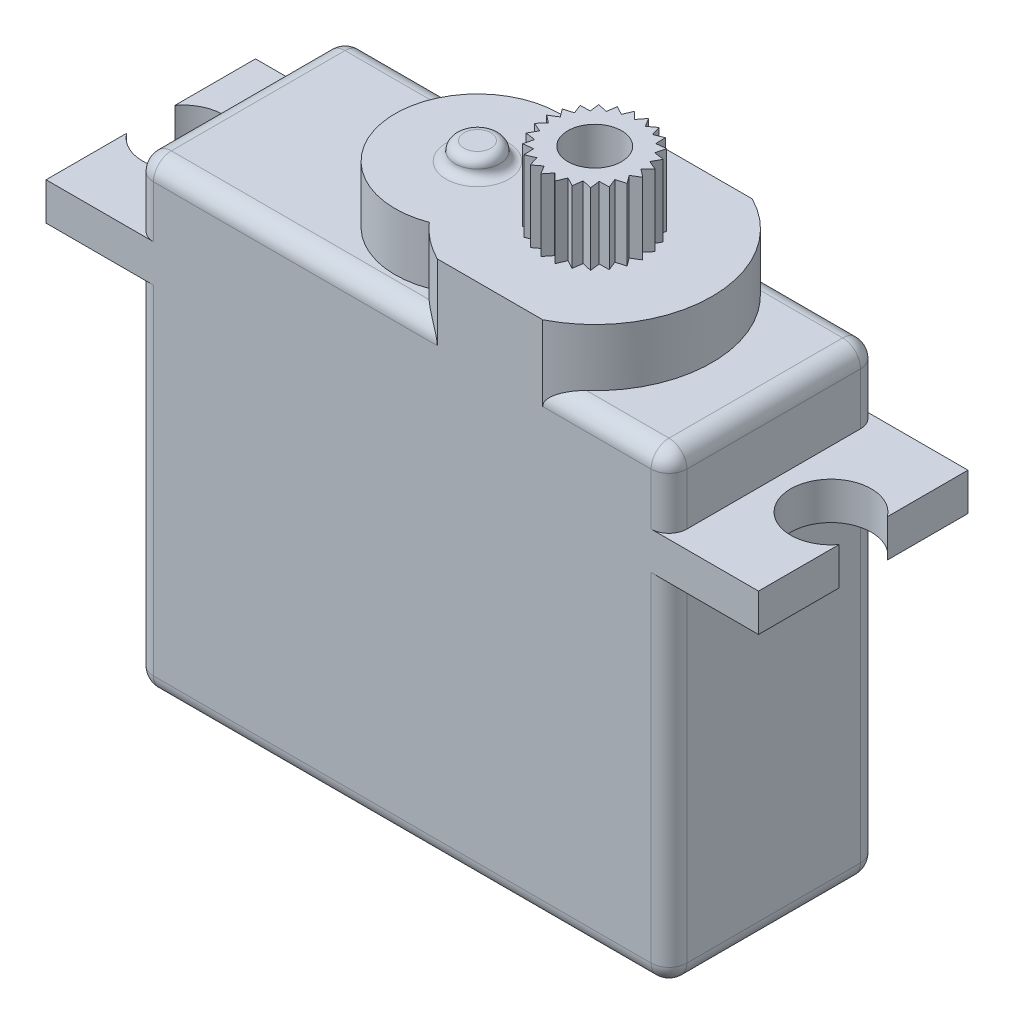
from build123d import *

# Parameters (mm, degrees)
EXTRUDE1_DEPTH    = 5.85
EXTRUDE2_START    = 9.05
SKETCH2_R         = 2.25
EXTRUDE2_DEPTH    = 2.1
EXTRUDE3_START    = 12.95
EXTRUDE3_DEPTH    = 3.2
EXTRUDE6_START    = 16.15
SKETCH6_R         = 1.25
EXTRUDE6_DEPTH    = 1
EXTRUDE4_START    = 16.15
SKETCH4_R         = 2.85
SKETCH4_R_2       = 1.5
EXTRUDE4_DEPTH    = 4
EXTRUDE5_START    = 16.15
EXTRUDE5_DEPTH    = 4
CIRPATTERN1_COUNT = 24
FILLET1_R         = 1
FILLET2_R         = 0.5


with BuildPart() as part:
    # Sketch1 → Extrude1 (new, symmetric)
    with BuildSketch(Plane.XY):
        Polygon((-14.9, -12.95), (-14.9, 6.95), (-19.9, 6.95), (-19.9, 9.05), (-14.9, 9.05), (-14.9, 12.95), (14.9, 12.95), (14.9, 9.05), (19.9, 9.05), (19.9, 6.95), (14.9, 6.95), (14.9, -12.95), align=None)
    extrude(amount=EXTRUDE1_DEPTH, both=True)

    # Sketch2 → Extrude2 (cut)
    with BuildSketch(Plane(origin=(0, 0, 0), x_dir=(1, 0, 0), z_dir=(0, 1, 0)).offset(EXTRUDE2_START)):
        with Locations((-18.1, 0)):
            Circle(SKETCH2_R)
        with Locations((18.1, 0)):
            Circle(SKETCH2_R)
    extrude(amount=-EXTRUDE2_DEPTH, mode=Mode.SUBTRACT)

    # Sketch3 → Extrude3 (add)
    with BuildSketch(Plane(origin=(0, 0, 0), x_dir=(1, 0, 0), z_dir=(0, 1, 0)).offset(EXTRUDE3_START)):
        with BuildLine():
            Line((7.846183973, 5.85), (1.953816027, 5.85))
            ThreePointArc((1.953816027, 5.85), (0.884733475, 5.174952631), (-0.034732824, 4.307076961))
            ThreePointArc((-0.034732824, 4.307076961), (-6.25, 0), (-0.034732824, -4.307076961))
            ThreePointArc((-0.034732824, -4.307076961), (0.884733475, -5.174952631), (1.953816027, -5.85))
            Line((1.953816027, -5.85), (7.846183973, -5.85))
            ThreePointArc((7.846183973, -5.85), (11.45, 0), (7.846183973, 5.85))
        make_face()
    extrude(amount=EXTRUDE3_DEPTH)

    # Sketch6 → Extrude6 (add)
    with BuildSketch(Plane(origin=(0, 0, 0), x_dir=(1, 0, 0), z_dir=(0, 1, 0)).offset(EXTRUDE6_START)):
        with Locations((-1.65, 0)):
            Circle(SKETCH6_R)
    extrude(amount=EXTRUDE6_DEPTH)

    # Sketch4 → Extrude4 (add)
    with BuildSketch(Plane(origin=(0, 0, 0), x_dir=(1, 0, 0), z_dir=(0, 1, 0)).offset(EXTRUDE4_START)):
        with Locations((4.9, 0)):
            Circle(SKETCH4_R)
        with Locations((4.9, 0)):
            Circle(SKETCH4_R_2, mode=Mode.SUBTRACT)
    extrude(amount=EXTRUDE4_DEPTH)

    # Sketch5 → Extrude5 (cut)
    with BuildSketch(Plane(origin=(0, 0, 0), x_dir=(1, 0, 0), z_dir=(0, 1, 0)).offset(EXTRUDE5_START)):
        with BuildLine():
            Line((4.005073985, -2.705846897), (4.447115963, -2.373874784))
            Line((4.447115963, -2.373874784), (4.735892559, -2.845271296))
            ThreePointArc((4.735892559, -2.845271296), (4.365914093, -2.799509286), (4.005073985, -2.705846897))
        make_face()
    extrude5 = extrude(amount=EXTRUDE5_DEPTH, mode=Mode.SUBTRACT)

    # CirPattern1: Extrude5 ×24 about axis
    cirpattern1_axis = Axis((4.9, 0, 0), (0, 1, 0))
    for i in range(1, CIRPATTERN1_COUNT):
        add(extrude5.rotate(cirpattern1_axis, i * 360 / CIRPATTERN1_COUNT), mode=Mode.SUBTRACT)

    # Fillet1
    fillet1_edges = [part.edges().sort_by_distance(p)[0] for p in [
        (11.373091986, 12.95, -5.85),
        (14.9, 12.95, 0),
        (11.373091986, 12.95, 5.85),
        (-6.473091986, 12.95, -5.85),
        (-14.9, 12.95, 0),
        (-6.473091986, 12.95, 5.85),
        (14.9, -12.95, 0),
        (-14.9, -12.95, 0),
        (0, -12.95, 5.85),
        (0, -12.95, -5.85),
        (14.9, 11, -5.85),
        (-14.9, 11, -5.85),
        (-14.9, 11, 5.85),
        (14.9, 11, 5.85),
        (14.9, -3, 5.85),
        (14.9, -3, -5.85),
        (-14.9, -3, -5.85),
        (-14.9, -3, 5.85),
    ]]
    fillet(fillet1_edges, radius=FILLET1_R)

    # Fillet2
    fillet2_edges = [part.edges().sort_by_distance(p)[0] for p in [
        (-2.9, 17.15, 0),
        (-2.9, 16.15, 0),
    ]]
    fillet(fillet2_edges, radius=FILLET2_R - 0.0001)  # a hair under: the kernel refuses the full size


solid = part.part
